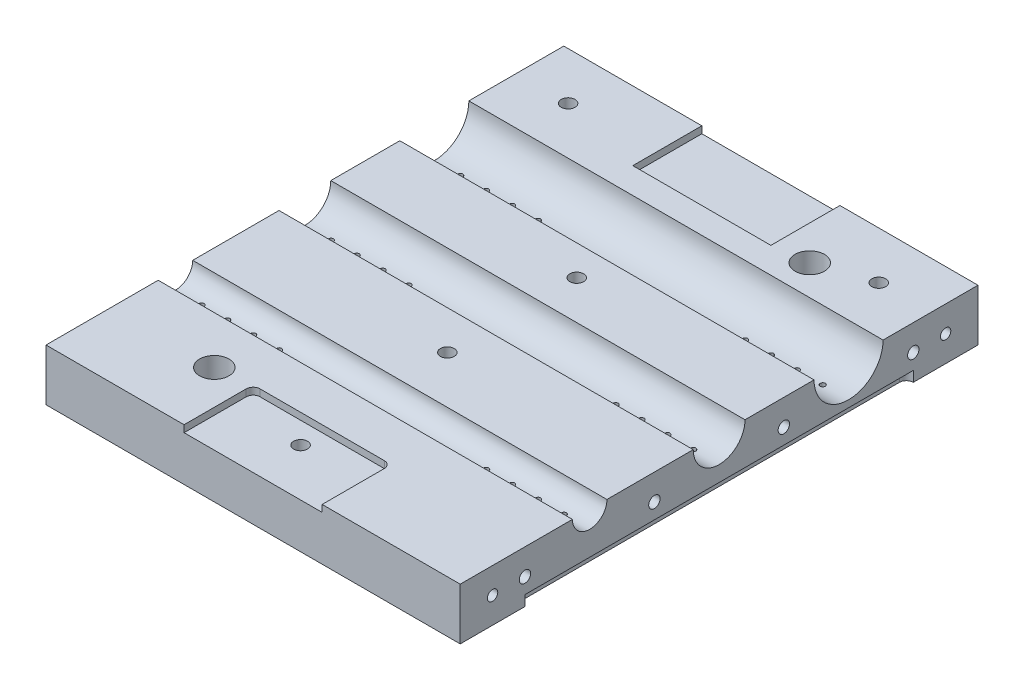
from build123d import *

# Parameters (mm, degrees)
SKETCH1_W                      = 120
SKETCH1_H                      = 150
BOSS_EXTRUDE1_DEPTH            = 15
SKETCH2_R                      = 5
SKETCH2_R_2                    = 7.5
SKETCH2_R_3                    = 10
CUT_EXTRUDE1_DEPTH             = 169.704986624
SKETCH9_W                      = 40
SKETCH9_H                      = 20
CUT_EXTRUDE2_DEPTH             = 2
F_1_5MM_DOWEL_HOLE1_AT_2_COUNT = 2
F_1_5MM_DOWEL_HOLE1_AT_2_PITCH = 7.5
F_1_5MM_DOWEL_HOLE1_AT_3_COUNT = 2
F_1_5MM_DOWEL_HOLE1_AT_3_PITCH = 15
F_1_5MM_DOWEL_HOLE1_AT_4_COUNT = 2
F_1_5MM_DOWEL_HOLE1_AT_4_PITCH = 22.5
F_1_5MM_DOWEL_HOLE1_AT_5_COUNT = 2
F_1_5MM_DOWEL_HOLE1_AT_5_PITCH = 37.5
F_1_5MM_DOWEL_HOLE1_AT_6_COUNT = 2
F_1_5MM_DOWEL_HOLE1_AT_6_PITCH = 38.242646352
F_1_5MM_DOWEL_HOLE1_AT_7_COUNT = 2
F_1_5MM_DOWEL_HOLE1_AT_7_PITCH = 40.388736054
F_1_5MM_DOWEL_HOLE1_AT_8_COUNT = 2
F_1_5MM_DOWEL_HOLE1_AT_8_PITCH = 43.732139211
SKETCH20_W                     = 2
SKETCH20_H                     = 112.5
CUT_EXTRUDE3_DEPTH             = 3
M10_TAPPED_HOLE2_D             = 8.5
M10_TAPPED_HOLE2_DEPTH         = 24.5
M10_TAPPED_HOLE2_TIP           = 2.553657631
F_4_0MM_DOWEL_HOLE1_D          = 4
F_4_0MM_DOWEL_HOLE1_DEPTH      = 25
F_4_0MM_DOWEL_HOLE1_TIP        = 1.201721238
FILLET1_R                      = 2
FILLET2_R                      = 2
F_4_0MM_DOWEL_HOLE2_D          = 4
F_4_0MM_DOWEL_HOLE2_DEPTH      = 20
F_4_0MM_DOWEL_HOLE2_TIP        = 1.201721238


with BuildPart() as part:
    # Sketch1 → Boss-Extrude1 (new body)
    with BuildSketch(Plane(origin=(0, 0, 0), x_dir=(1, 0, 0), z_dir=(0, 1, 0))):
        with Locations((15.472658693, -42.628111061)):
            Rectangle(SKETCH1_W, SKETCH1_H)
    extrude(amount=BOSS_EXTRUDE1_DEPTH)

    # Sketch2 → Cut-Extrude1 (cut, through all)
    with BuildSketch(Plane(origin=(75.472658693, 0, 0), x_dir=(0, 0, -1), z_dir=(1, 0, 0))):
        with Locations((-80.128111061, 15)):
            Circle(SKETCH2_R)
        with Locations((-42.628111061, 15)):
            Circle(SKETCH2_R_2)
        with Locations((-5.128111061, 15)):
            Circle(SKETCH2_R_3)
    extrude(amount=-CUT_EXTRUDE1_DEPTH, mode=Mode.SUBTRACT)

    # Sketch9 → Cut-Extrude2 (cut)
    with BuildSketch(Plane(origin=(0, 15, 0), x_dir=(1, 0, 0), z_dir=(0, 1, 0))):
        with Locations((15.472658693, -107.628111061)):
            Rectangle(SKETCH9_W, SKETCH9_H)
    cut_extrude2 = extrude(amount=-CUT_EXTRUDE2_DEPTH, mode=Mode.SUBTRACT)

    # Mirror2: Cut-Extrude2 across plane
    add(cut_extrude2.mirror(Plane.XY.offset(42.628111061)), mode=Mode.SUBTRACT)

    # Sketch12 → M4 Tapped Hole2 (revolve, cut)
    with BuildSketch(Plane(origin=(75.472658693, 7.5, 61.378111061), x_dir=(0, 0, -1), z_dir=(0, 1, 0))):
        Polygon((0, 0), (0, 20.991420021), (1.65, 20), (1.65, 0), align=None)
    m4_tapped_hole2 = revolve(axis=Axis((81.822658693, 7.5, 61.378111061), (-1, 0, 0)), mode=Mode.SUBTRACT)

    # Mirror3: M4 Tapped Hole2 across plane
    add(m4_tapped_hole2.mirror(Plane.XY.offset(42.628111061)), mode=Mode.SUBTRACT)

    # Mirror4: M4 Tapped Hole2 across plane
    add(m4_tapped_hole2.mirror(Plane(origin=(15.472658693, 0, 0), x_dir=(0, 0, 1), z_dir=(1, 0, 0))), mode=Mode.SUBTRACT)

    # Mirror4 copy 1 sketch → Mirror4 copy 1 (revolve, cut)
    with BuildSketch(Plane(origin=(-44.527341307, 7.5, 23.878111061), x_dir=(0, 0, 1), z_dir=(0, 1, 0))):
        Polygon((0, 0), (0, 20.991420021), (1.65, 20), (1.65, 0), align=None)
    revolve(axis=Axis((-50.877341307, 7.5, 23.878111061), (1, 0, 0)), mode=Mode.SUBTRACT)

    # Sketch15 → M4 Tapped Hole3 (revolve, cut)
    with BuildSketch(Plane(origin=(75.472658693, 7.5, 98.878111061), x_dir=(0, 0, -1), z_dir=(0, 1, 0))):
        Polygon((0, 0), (0, 20.991420021), (1.65, 20), (1.65, 0), align=None)
    m4_tapped_hole3 = revolve(axis=Axis((81.822658693, 7.5, 98.878111061), (-1, 0, 0)), mode=Mode.SUBTRACT)

    # Mirror5: M4 Tapped Hole3 across plane
    add(m4_tapped_hole3.mirror(Plane.XY.offset(42.628111061)), mode=Mode.SUBTRACT)

    # Mirror6: M4 Tapped Hole3 across plane
    add(m4_tapped_hole3.mirror(Plane(origin=(15.472658693, 0, 0), x_dir=(0, 0, 1), z_dir=(1, 0, 0))), mode=Mode.SUBTRACT)

    # Mirror6 copy 1 sketch → Mirror6 copy 1 (revolve, cut)
    with BuildSketch(Plane(origin=(-44.527341307, 7.5, -13.621888939), x_dir=(0, 0, 1), z_dir=(0, 1, 0))):
        Polygon((0, 0), (0, 20.991420021), (1.65, 20), (1.65, 0), align=None)
    revolve(axis=Axis((-50.877341307, 7.5, -13.621888939), (1, 0, 0)), mode=Mode.SUBTRACT)

    # Sketch19 → Ø1.5mm Dowel Hole1 (revolve, cut)
    with BuildSketch(Plane(origin=(67.972658693, 15, 5.128111061), x_dir=(0, 0, 1), z_dir=(1, 0, 0))):
        Polygon((0, 0), (0, 25.450645464), (0.75, 25), (0.75, 0), align=None)
    f_1_5mm_dowel_hole1 = revolve(axis=Axis((67.972658693, 21.35, 5.128111061), (0, -1, 0)), mode=Mode.SUBTRACT)

    # Ø1.5mm Dowel Hole1 at 2: Ø1.5mm Dowel Hole1 ×2
    with Locations(*[(-i * F_1_5MM_DOWEL_HOLE1_AT_2_PITCH, 0, 0) for i in range(1, F_1_5MM_DOWEL_HOLE1_AT_2_COUNT)]):
        add(f_1_5mm_dowel_hole1, mode=Mode.SUBTRACT)

    # Ø1.5mm Dowel Hole1 at 3: Ø1.5mm Dowel Hole1 ×2
    with Locations(*[(-i * F_1_5MM_DOWEL_HOLE1_AT_3_PITCH, 0, 0) for i in range(1, F_1_5MM_DOWEL_HOLE1_AT_3_COUNT)]):
        add(f_1_5mm_dowel_hole1, mode=Mode.SUBTRACT)

    # Ø1.5mm Dowel Hole1 at 4: Ø1.5mm Dowel Hole1 ×2
    with Locations(*[(-i * F_1_5MM_DOWEL_HOLE1_AT_4_PITCH, 0, 0) for i in range(1, F_1_5MM_DOWEL_HOLE1_AT_4_COUNT)]):
        add(f_1_5mm_dowel_hole1, mode=Mode.SUBTRACT)

    # Ø1.5mm Dowel Hole1 at 5: Ø1.5mm Dowel Hole1 ×2
    with Locations(*[(0, 0, i * F_1_5MM_DOWEL_HOLE1_AT_5_PITCH) for i in range(1, F_1_5MM_DOWEL_HOLE1_AT_5_COUNT)]):
        add(f_1_5mm_dowel_hole1, mode=Mode.SUBTRACT)

    # Ø1.5mm Dowel Hole1 at 6: Ø1.5mm Dowel Hole1 ×2
    with Locations(*[Vector(-0.1961161351381842, 0, 0.9805806756909201) * (i * F_1_5MM_DOWEL_HOLE1_AT_6_PITCH) for i in range(1, F_1_5MM_DOWEL_HOLE1_AT_6_COUNT)]):
        add(f_1_5mm_dowel_hole1, mode=Mode.SUBTRACT)

    # Ø1.5mm Dowel Hole1 at 7: Ø1.5mm Dowel Hole1 ×2
    with Locations(*[Vector(-0.3713906763541039, 0, 0.9284766908852593) * (i * F_1_5MM_DOWEL_HOLE1_AT_7_PITCH) for i in range(1, F_1_5MM_DOWEL_HOLE1_AT_7_COUNT)]):
        add(f_1_5mm_dowel_hole1, mode=Mode.SUBTRACT)

    # Ø1.5mm Dowel Hole1 at 8: Ø1.5mm Dowel Hole1 ×2
    with Locations(*[Vector(-0.5144957554275267, 0, 0.8574929257125441) * (i * F_1_5MM_DOWEL_HOLE1_AT_8_PITCH) for i in range(1, F_1_5MM_DOWEL_HOLE1_AT_8_COUNT)]):
        add(f_1_5mm_dowel_hole1, mode=Mode.SUBTRACT)

    # Mirror7: Ø1.5mm Dowel Hole1 across plane
    add(f_1_5mm_dowel_hole1.mirror(Plane.XY.offset(42.628111061)), mode=Mode.SUBTRACT)

    # Mirror7 copy 1 sketch → Mirror7 copy 1 (revolve, cut)
    with BuildSketch(Plane(origin=(60.472658693, 15, 80.128111061), x_dir=(0, 0, -1), z_dir=(1, 0, 0))):
        Polygon((0, 0), (0, -25.450645464), (0.75, -25), (0.75, 0), align=None)
    revolve(axis=Axis((60.472658693, 21.35, 80.128111061), (0, 1, 0)), mode=Mode.SUBTRACT)

    # Mirror7 copy 2 sketch → Mirror7 copy 2 (revolve, cut)
    with BuildSketch(Plane(origin=(52.972658693, 15, 80.128111061), x_dir=(0, 0, -1), z_dir=(1, 0, 0))):
        Polygon((0, 0), (0, -25.450645464), (0.75, -25), (0.75, 0), align=None)
    revolve(axis=Axis((52.972658693, 21.35, 80.128111061), (0, 1, 0)), mode=Mode.SUBTRACT)

    # Mirror7 copy 3 sketch → Mirror7 copy 3 (revolve, cut)
    with BuildSketch(Plane(origin=(45.472658693, 15, 80.128111061), x_dir=(0, 0, -1), z_dir=(1, 0, 0))):
        Polygon((0, 0), (0, -25.450645464), (0.75, -25), (0.75, 0), align=None)
    revolve(axis=Axis((45.472658693, 21.35, 80.128111061), (0, 1, 0)), mode=Mode.SUBTRACT)

    # Mirror7 copy 4 sketch → Mirror7 copy 4 (revolve, cut)
    with BuildSketch(Plane(origin=(67.972658693, 15, 42.628111061), x_dir=(0, 0, -1), z_dir=(1, 0, 0))):
        Polygon((0, 0), (0, -25.450645464), (0.75, -25), (0.75, 0), align=None)
    revolve(axis=Axis((67.972658693, 21.35, 42.628111061), (0, 1, 0)), mode=Mode.SUBTRACT)

    # Mirror7 copy 5 sketch → Mirror7 copy 5 (revolve, cut)
    with BuildSketch(Plane(origin=(60.472658693, 15, 42.628111061), x_dir=(0, 0, -1), z_dir=(1, 0, 0))):
        Polygon((0, 0), (0, -25.450645464), (0.75, -25), (0.75, 0), align=None)
    revolve(axis=Axis((60.472658693, 21.35, 42.628111061), (0, 1, 0)), mode=Mode.SUBTRACT)

    # Mirror7 copy 6 sketch → Mirror7 copy 6 (revolve, cut)
    with BuildSketch(Plane(origin=(52.972658693, 15, 42.628111061), x_dir=(0, 0, -1), z_dir=(1, 0, 0))):
        Polygon((0, 0), (0, -25.450645464), (0.75, -25), (0.75, 0), align=None)
    revolve(axis=Axis((52.972658693, 21.35, 42.628111061), (0, 1, 0)), mode=Mode.SUBTRACT)

    # Mirror7 copy 7 sketch → Mirror7 copy 7 (revolve, cut)
    with BuildSketch(Plane(origin=(45.472658693, 15, 42.628111061), x_dir=(0, 0, -1), z_dir=(1, 0, 0))):
        Polygon((0, 0), (0, -25.450645464), (0.75, -25), (0.75, 0), align=None)
    revolve(axis=Axis((45.472658693, 21.35, 42.628111061), (0, 1, 0)), mode=Mode.SUBTRACT)

    # Mirror8: Ø1.5mm Dowel Hole1 across plane
    add(f_1_5mm_dowel_hole1.mirror(Plane(origin=(15.472658693, 0, 0), x_dir=(0, 0, 1), z_dir=(1, 0, 0))), mode=Mode.SUBTRACT)

    # Mirror8 copy 1 sketch → Mirror8 copy 1 (revolve, cut)
    with BuildSketch(Plane(origin=(-29.527341307, 15, 5.128111061), x_dir=(0, 0, 1), z_dir=(-1, 0, 0))):
        Polygon((0, 0), (0, -25.450645464), (0.75, -25), (0.75, 0), align=None)
    revolve(axis=Axis((-29.527341307, 21.35, 5.128111061), (0, 1, 0)), mode=Mode.SUBTRACT)

    # Mirror8 copy 2 sketch → Mirror8 copy 2 (revolve, cut)
    with BuildSketch(Plane(origin=(-22.027341307, 15, 5.128111061), x_dir=(0, 0, 1), z_dir=(-1, 0, 0))):
        Polygon((0, 0), (0, -25.450645464), (0.75, -25), (0.75, 0), align=None)
    revolve(axis=Axis((-22.027341307, 21.35, 5.128111061), (0, 1, 0)), mode=Mode.SUBTRACT)

    # Mirror8 copy 3 sketch → Mirror8 copy 3 (revolve, cut)
    with BuildSketch(Plane(origin=(-14.527341307, 15, 5.128111061), x_dir=(0, 0, 1), z_dir=(-1, 0, 0))):
        Polygon((0, 0), (0, -25.450645464), (0.75, -25), (0.75, 0), align=None)
    revolve(axis=Axis((-14.527341307, 21.35, 5.128111061), (0, 1, 0)), mode=Mode.SUBTRACT)

    # Mirror8 copy 4 sketch → Mirror8 copy 4 (revolve, cut)
    with BuildSketch(Plane(origin=(-37.027341307, 15, 42.628111061), x_dir=(0, 0, 1), z_dir=(-1, 0, 0))):
        Polygon((0, 0), (0, -25.450645464), (0.75, -25), (0.75, 0), align=None)
    revolve(axis=Axis((-37.027341307, 21.35, 42.628111061), (0, 1, 0)), mode=Mode.SUBTRACT)

    # Mirror8 copy 5 sketch → Mirror8 copy 5 (revolve, cut)
    with BuildSketch(Plane(origin=(-29.527341307, 15, 42.628111061), x_dir=(0, 0, 1), z_dir=(-1, 0, 0))):
        Polygon((0, 0), (0, -25.450645464), (0.75, -25), (0.75, 0), align=None)
    revolve(axis=Axis((-29.527341307, 21.35, 42.628111061), (0, 1, 0)), mode=Mode.SUBTRACT)

    # Mirror8 copy 6 sketch → Mirror8 copy 6 (revolve, cut)
    with BuildSketch(Plane(origin=(-22.027341307, 15, 42.628111061), x_dir=(0, 0, 1), z_dir=(-1, 0, 0))):
        Polygon((0, 0), (0, -25.450645464), (0.75, -25), (0.75, 0), align=None)
    revolve(axis=Axis((-22.027341307, 21.35, 42.628111061), (0, 1, 0)), mode=Mode.SUBTRACT)

    # Mirror8 copy 7 sketch → Mirror8 copy 7 (revolve, cut)
    with BuildSketch(Plane(origin=(-14.527341307, 15, 42.628111061), x_dir=(0, 0, 1), z_dir=(-1, 0, 0))):
        Polygon((0, 0), (0, -25.450645464), (0.75, -25), (0.75, 0), align=None)
    revolve(axis=Axis((-14.527341307, 21.35, 42.628111061), (0, 1, 0)), mode=Mode.SUBTRACT)

    # Mirror8 copy 8 sketch → Mirror8 copy 8 (revolve, cut)
    with BuildSketch(Plane(origin=(-37.027341307, 15, 80.128111061), x_dir=(0, 0, -1), z_dir=(-1, 0, 0))):
        Polygon((0, 0), (0, 25.450645464), (0.75, 25), (0.75, 0), align=None)
    revolve(axis=Axis((-37.027341307, 21.35, 80.128111061), (0, -1, 0)), mode=Mode.SUBTRACT)

    # Mirror8 copy 9 sketch → Mirror8 copy 9 (revolve, cut)
    with BuildSketch(Plane(origin=(-29.527341307, 15, 80.128111061), x_dir=(0, 0, -1), z_dir=(-1, 0, 0))):
        Polygon((0, 0), (0, 25.450645464), (0.75, 25), (0.75, 0), align=None)
    revolve(axis=Axis((-29.527341307, 21.35, 80.128111061), (0, -1, 0)), mode=Mode.SUBTRACT)

    # Mirror8 copy 10 sketch → Mirror8 copy 10 (revolve, cut)
    with BuildSketch(Plane(origin=(-22.027341307, 15, 80.128111061), x_dir=(0, 0, -1), z_dir=(-1, 0, 0))):
        Polygon((0, 0), (0, 25.450645464), (0.75, 25), (0.75, 0), align=None)
    revolve(axis=Axis((-22.027341307, 21.35, 80.128111061), (0, -1, 0)), mode=Mode.SUBTRACT)

    # Mirror8 copy 11 sketch → Mirror8 copy 11 (revolve, cut)
    with BuildSketch(Plane(origin=(-14.527341307, 15, 80.128111061), x_dir=(0, 0, -1), z_dir=(-1, 0, 0))):
        Polygon((0, 0), (0, 25.450645464), (0.75, 25), (0.75, 0), align=None)
    revolve(axis=Axis((-14.527341307, 21.35, 80.128111061), (0, -1, 0)), mode=Mode.SUBTRACT)

    # Mirror8 copy 12 sketch → Mirror8 copy 12 (revolve, cut)
    with BuildSketch(Plane(origin=(-37.027341307, 15, 42.628111061), x_dir=(0, 0, -1), z_dir=(-1, 0, 0))):
        Polygon((0, 0), (0, 25.450645464), (0.75, 25), (0.75, 0), align=None)
    revolve(axis=Axis((-37.027341307, 21.35, 42.628111061), (0, -1, 0)), mode=Mode.SUBTRACT)

    # Mirror8 copy 13 sketch → Mirror8 copy 13 (revolve, cut)
    with BuildSketch(Plane(origin=(-29.527341307, 15, 42.628111061), x_dir=(0, 0, -1), z_dir=(-1, 0, 0))):
        Polygon((0, 0), (0, 25.450645464), (0.75, 25), (0.75, 0), align=None)
    revolve(axis=Axis((-29.527341307, 21.35, 42.628111061), (0, -1, 0)), mode=Mode.SUBTRACT)

    # Mirror8 copy 14 sketch → Mirror8 copy 14 (revolve, cut)
    with BuildSketch(Plane(origin=(-22.027341307, 15, 42.628111061), x_dir=(0, 0, -1), z_dir=(-1, 0, 0))):
        Polygon((0, 0), (0, 25.450645464), (0.75, 25), (0.75, 0), align=None)
    revolve(axis=Axis((-22.027341307, 21.35, 42.628111061), (0, -1, 0)), mode=Mode.SUBTRACT)

    # Mirror8 copy 15 sketch → Mirror8 copy 15 (revolve, cut)
    with BuildSketch(Plane(origin=(-14.527341307, 15, 42.628111061), x_dir=(0, 0, -1), z_dir=(-1, 0, 0))):
        Polygon((0, 0), (0, 25.450645464), (0.75, 25), (0.75, 0), align=None)
    revolve(axis=Axis((-14.527341307, 21.35, 42.628111061), (0, -1, 0)), mode=Mode.SUBTRACT)

    # Sketch20 → Cut-Extrude3 (cut)
    with BuildSketch(Plane.XZ):
        with Locations((-43.527341307, 42.628111061)):
            Rectangle(SKETCH20_W, SKETCH20_H)
    cut_extrude3 = extrude(amount=-CUT_EXTRUDE3_DEPTH, mode=Mode.SUBTRACT)

    # Mirror9: Cut-Extrude3 across plane
    add(cut_extrude3.mirror(Plane(origin=(15.472658693, 0, 0), x_dir=(0, 0, 1), z_dir=(1, 0, 0))), mode=Mode.SUBTRACT)

    # Sketch23 → Ø3.0mm Dowel Hole1 (revolve, cut)
    with BuildSketch(Plane(origin=(75.472658693, 7.5, 108.253111061), x_dir=(0, 0, -1), z_dir=(0, 1, 0))):
        Polygon((0, 0), (0, 25.901290929), (1.5, 25), (1.5, 0), align=None)
    f_3_0mm_dowel_hole1 = revolve(axis=Axis((81.822658693, 7.5, 108.253111061), (-1, 0, 0)), mode=Mode.SUBTRACT)

    # Mirror10: Ø3.0mm Dowel Hole1 across plane
    add(f_3_0mm_dowel_hole1.mirror(Plane.XY.offset(42.628111061)), mode=Mode.SUBTRACT)

    # Mirror11: Ø3.0mm Dowel Hole1 across plane
    add(f_3_0mm_dowel_hole1.mirror(Plane(origin=(15.472658693, 0, 0), x_dir=(0, 0, 1), z_dir=(1, 0, 0))), mode=Mode.SUBTRACT)

    # Mirror11 copy 1 sketch → Mirror11 copy 1 (revolve, cut)
    with BuildSketch(Plane(origin=(-44.527341307, 7.5, -22.996888939), x_dir=(0, 0, 1), z_dir=(0, 1, 0))):
        Polygon((0, 0), (0, 25.901290929), (1.5, 25), (1.5, 0), align=None)
    revolve(axis=Axis((-50.877341307, 7.5, -22.996888939), (1, 0, 0)), mode=Mode.SUBTRACT)

    # M10 Tapped Hole2
    with Locations(Plane(origin=(45.472658693, 0, -13.621888939), x_dir=(0, 0, -1), z_dir=(0, -1, 0))):
        with Locations((0, 0), (-112.5, -60)):
            Hole(M10_TAPPED_HOLE2_D / 2, depth=M10_TAPPED_HOLE2_DEPTH)
            with Locations((0, 0, -(M10_TAPPED_HOLE2_DEPTH + M10_TAPPED_HOLE2_TIP / 2))):  # 118° drill point
                Cone(0, M10_TAPPED_HOLE2_D / 2, M10_TAPPED_HOLE2_TIP, mode=Mode.SUBTRACT)

    # Ø4.0mm Dowel Hole1
    with Locations(Plane(origin=(60.472658693, 15, -18.621888939), x_dir=(0, 0, 1), z_dir=(0, 1, 0))):
        with Locations((0, 0), (0, -90), (122.5, -45)):
            Hole(F_4_0MM_DOWEL_HOLE1_D / 2, depth=F_4_0MM_DOWEL_HOLE1_DEPTH)
            with Locations((0, 0, -(F_4_0MM_DOWEL_HOLE1_DEPTH + F_4_0MM_DOWEL_HOLE1_TIP / 2))):  # 118° drill point
                Cone(0, F_4_0MM_DOWEL_HOLE1_D / 2, F_4_0MM_DOWEL_HOLE1_TIP, mode=Mode.SUBTRACT)

    # Fillet1
    fillet1_edges = [part.edges().sort_by_distance(p)[0] for p in [
        (73.472658693, 1.5, -13.621888939),
        (73.472658693, 1.5, 98.878111061),
    ]]
    fillet(fillet1_edges, radius=FILLET1_R - 0.0001)  # a hair under: the kernel refuses the full size

    # Fillet2
    fillet2_edges = [part.edges().sort_by_distance(p)[0] for p in [
        (-4.527341307, 14, 97.628111061),
        (35.472658693, 14, 97.628111061),
    ]]
    fillet(fillet2_edges, radius=FILLET2_R)

    # Ø4.0mm Dowel Hole2
    with Locations(Plane(origin=(0, 0, 0), x_dir=(-1, 0, 0), z_dir=(0, -1, 0))):
        with Locations((-15.472658693, -61.378111061), (-15.472658693, -23.878111061)):
            Hole(F_4_0MM_DOWEL_HOLE2_D / 2, depth=F_4_0MM_DOWEL_HOLE2_DEPTH)
            with Locations((0, 0, -(F_4_0MM_DOWEL_HOLE2_DEPTH + F_4_0MM_DOWEL_HOLE2_TIP / 2))):  # 118° drill point
                Cone(0, F_4_0MM_DOWEL_HOLE2_D / 2, F_4_0MM_DOWEL_HOLE2_TIP, mode=Mode.SUBTRACT)


solid = part.part
